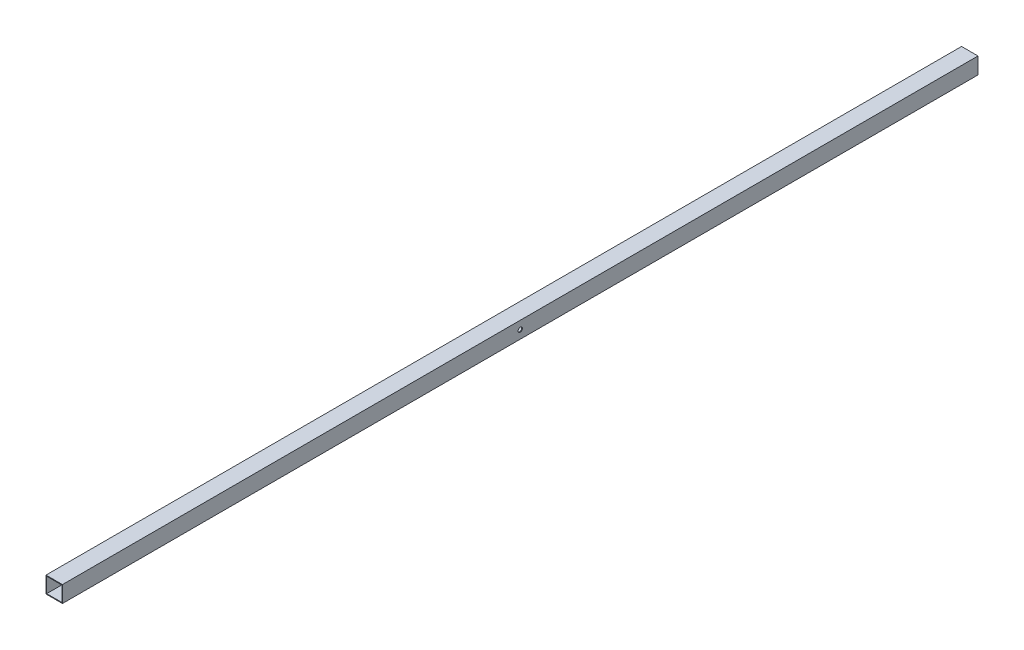
from build123d import *

# Parameters (mm, degrees)
SKETCH2_W                = 38.1
SKETCH2_H                = 38.1
SKETCH2_W_2              = 34.925
SKETCH2_H_2              = 34.925
BOSS_EXTRUDE1_DEPTH      = 2120.9
X_0_397_DIAMETER_HOLE1_D = 10.0838


with BuildPart() as part:
    # Sketch2 → Boss-Extrude1 (new body)
    with BuildSketch(Plane.XY):
        with Locations((19.05, 19.05)):
            Rectangle(SKETCH2_W, SKETCH2_H)
        with Locations((19.05, 19.05)):
            Rectangle(SKETCH2_W_2, SKETCH2_H_2, mode=Mode.SUBTRACT)
    extrude(amount=BOSS_EXTRUDE1_DEPTH)

    # X (0.397) Diameter Hole1 (through all)
    with Locations(Plane(origin=(38.1, 0, 0), x_dir=(0, 0, -1), z_dir=(1, 0, 0))):
        with Locations((-1060.45, 19.05)):
            Hole(X_0_397_DIAMETER_HOLE1_D / 2)


solid = part.part
